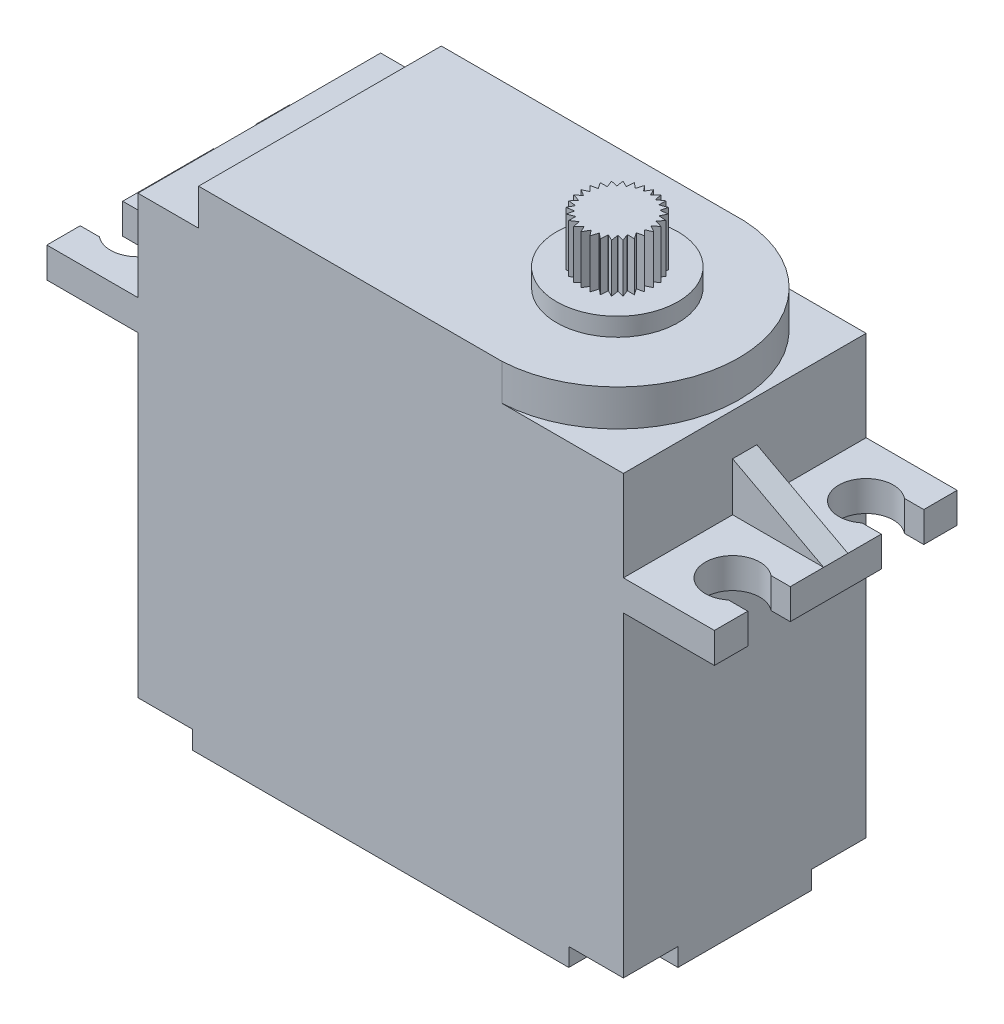
from build123d import *

# Parameters (mm, degrees)
SKETCH1_W           = 40
SKETCH1_H           = 20
BOSS_EXTRUDE1_DEPTH = 40.5
SKETCH2_R           = 5
BOSS_EXTRUDE2_DEPTH = 1.5
SKETCH3_W           = 20
SKETCH3_H           = 2.5
BOSS_EXTRUDE3_DEPTH = 7.5
SKETCH4_W           = 20
SKETCH4_H           = 2.5
BOSS_EXTRUDE4_DEPTH = 7.5
SKETCH5_W           = 5
SKETCH5_H           = 20
CUT_EXTRUDE1_DEPTH  = 3
SKETCH6_R           = 3
BOSS_EXTRUDE5_DEPTH = 4
SKETCH7_OUTSIDE_W   = 71.888
SKETCH7_OUTSIDE_H   = 36.888
CUT_EXTRUDE2_DEPTH  = 4
BOSS_EXTRUDE6_START = 4
SKETCH8_R           = 2.500178688
BOSS_EXTRUDE6_DEPTH = 4
SKETCH9_W           = 7.5
SKETCH9_H           = 2
BOSS_EXTRUDE7_DEPTH = 4
CHAMFER1_SIZE2      = 7.5
CHAMFER1_SIZE       = 4
CHAMFER2_SIZE2      = 7.5
CHAMFER2_SIZE       = 4
CUT_EXTRUDE3_REACH  = 61.659
SKETCH11_W          = 4.5
SKETCH11_H          = 4.5
CUT_EXTRUDE4_DEPTH  = 1.5
FILLET1_R           = 2.25


with BuildPart() as part:
    # Sketch1 → Boss-Extrude1 (new body)
    with BuildSketch(Plane(origin=(0, 0, 0), x_dir=(1, 0, 0), z_dir=(0, 1, 0))):
        with Locations((20, 10)):
            Rectangle(SKETCH1_W, SKETCH1_H)
    extrude(amount=BOSS_EXTRUDE1_DEPTH)

    # Sketch2 → Boss-Extrude2 (add)
    with BuildSketch(Plane(origin=(0, 40.5, 0), x_dir=(1, 0, 0), z_dir=(0, 1, 0))):
        with Locations(Location((29.5, 10, 0), (0, 0, 90))):
            Circle(SKETCH2_R)
    extrude(amount=BOSS_EXTRUDE2_DEPTH)

    # Sketch3 → Boss-Extrude3 (add)
    with BuildSketch(Plane(origin=(40, 0, 0), x_dir=(0, 0, -1), z_dir=(1, 0, 0))):
        with Locations((10, 28.8)):
            Rectangle(SKETCH3_W, SKETCH3_H)
    extrude(amount=BOSS_EXTRUDE3_DEPTH)

    # Sketch4 → Boss-Extrude4 (add)
    with BuildSketch(Plane.ZY):
        with Locations((-10, 28.8)):
            Rectangle(SKETCH4_W, SKETCH4_H)
    extrude(amount=BOSS_EXTRUDE4_DEPTH)

    # Sketch5 → Cut-Extrude1 (cut)
    with BuildSketch(Plane(origin=(0, 40.5, 0), x_dir=(1, 0, 0), z_dir=(0, 1, 0))):
        with Locations((2.5, 10)):
            Rectangle(SKETCH5_W, SKETCH5_H)
        with BuildLine():
            Line((30, 0), (40, 0))
            Line((40, 0), (40, 20))
            Line((40, 20), (30, 20))
            ThreePointArc((30, 20), (39.512492197, 10), (30, 0))
        make_face()
    extrude(amount=-CUT_EXTRUDE1_DEPTH, mode=Mode.SUBTRACT)

    # Sketch6 → Boss-Extrude5 (add)
    with BuildSketch(Plane(origin=(0, 42, 0), x_dir=(1, 0, 0), z_dir=(0, 1, 0))):
        with Locations(Location((29.5, 10, 0), (0, 0, 270))):
            Circle(SKETCH6_R)
    extrude(amount=BOSS_EXTRUDE5_DEPTH)

    # Sketch7 outside → Cut-Extrude2 (cut)
    with BuildSketch(Plane(origin=(0, 46, 0), x_dir=(1, 0, 0), z_dir=(0, 1, 0))):
        with Locations((20, 10)):
            Rectangle(SKETCH7_OUTSIDE_W, SKETCH7_OUTSIDE_H)
        with BuildLine():
            Line((29.5, 13), (29.197535282, 12.481815579))
            ThreePointArc((29.197535282, 12.481815579), (29.467797841, 12.499971299), (29.738438382, 12.488782958))
            Line((29.738438382, 12.488782958), (29.5, 13))
        make_face(mode=Mode.SUBTRACT)
        with BuildLine():
            Line((30.167562802, 12.924783737), (29.757374624, 12.486896012))
            ThreePointArc((29.757374624, 12.486896012), (30.024901165, 12.444457453), (30.286266542, 12.373326442))
            Line((30.286266542, 12.373326442), (30.167562802, 12.924783737))
        make_face(mode=Mode.SUBTRACT)
        with BuildLine():
            Line((30.801651217, 12.702906604), (30.304308129, 12.367273095))
            ThreePointArc((30.304308129, 12.367273095), (30.555683752, 12.266368304), (30.794668015, 12.138861427))
            Line((30.794668015, 12.138861427), (30.801651217, 12.702906604))
        make_face(mode=Mode.SUBTRACT)
        with BuildLine():
            Line((31.370469406, 12.345494447), (30.810910265, 12.12894522))
            ThreePointArc((30.810910265, 12.12894522), (31.033529948, 11.974633984), (31.238149427, 11.79714497))
            Line((31.238149427, 11.79714497), (31.370469406, 12.345494447))
        make_face(mode=Mode.SUBTRACT)
        with BuildLine():
            Line((31.845494447, 11.870469406), (31.251777886, 11.783863142))
            ThreePointArc((31.251777886, 11.783863142), (31.434478549, 11.583883271), (31.594472769, 11.36531216))
            Line((31.594472769, 11.36531216), (31.845494447, 11.870469406))
        make_face(mode=Mode.SUBTRACT)
        with BuildLine():
            Line((32.202906604, 11.301651217), (31.60480405, 11.349330718))
            ThreePointArc((31.60480405, 11.349330718), (31.738424318, 11.113710037), (31.845770501, 10.865016897))
            Line((31.845770501, 10.865016897), (32.202906604, 11.301651217))
        make_face(mode=Mode.SUBTRACT)
        with BuildLine():
            Line((32.424783737, 10.667562802), (31.852286549, 10.847137217))
            ThreePointArc((31.852286549, 10.847137217), (31.930126144, 10.587690732), (31.979441504, 10.321346074))
            Line((31.979441504, 10.321346074), (32.424783737, 10.667562802))
        make_face(mode=Mode.SUBTRACT)
        with BuildLine():
            Line((32.5, 10), (31.981815579, 10.302464718))
            ThreePointArc((31.981815579, 10.302464718), (31.999971299, 10.032202159), (31.988782958, 9.761561618))
            Line((31.988782958, 9.761561618), (32.5, 10))
        make_face(mode=Mode.SUBTRACT)
        with BuildLine():
            Line((32.424783737, 9.332437198), (31.986896012, 9.742625376))
            ThreePointArc((31.986896012, 9.742625376), (31.944457453, 9.475098835), (31.873326442, 9.213733458))
            Line((31.873326442, 9.213733458), (32.424783737, 9.332437198))
        make_face(mode=Mode.SUBTRACT)
        with BuildLine():
            Line((32.202906604, 8.698348783), (31.867273095, 9.195691871))
            ThreePointArc((31.867273095, 9.195691871), (31.766368304, 8.944316248), (31.638861427, 8.705331985))
            Line((31.638861427, 8.705331985), (32.202906604, 8.698348783))
        make_face(mode=Mode.SUBTRACT)
        with BuildLine():
            Line((31.845494447, 8.129530594), (31.62894522, 8.689089735))
            ThreePointArc((31.62894522, 8.689089735), (31.474633984, 8.466470052), (31.29714497, 8.261850573))
            Line((31.29714497, 8.261850573), (31.845494447, 8.129530594))
        make_face(mode=Mode.SUBTRACT)
        with BuildLine():
            Line((31.370469406, 7.654505553), (31.283863142, 8.248222114))
            ThreePointArc((31.283863142, 8.248222114), (31.083883271, 8.065521451), (30.86531216, 7.905527231))
            Line((30.86531216, 7.905527231), (31.370469406, 7.654505553))
        make_face(mode=Mode.SUBTRACT)
        with BuildLine():
            Line((30.801651217, 7.297093396), (30.849330718, 7.89519595))
            ThreePointArc((30.849330718, 7.89519595), (30.613710037, 7.761575682), (30.365016897, 7.654229499))
            Line((30.365016897, 7.654229499), (30.801651217, 7.297093396))
        make_face(mode=Mode.SUBTRACT)
        with BuildLine():
            Line((30.167562802, 7.075216263), (30.347137217, 7.647713451))
            ThreePointArc((30.347137217, 7.647713451), (30.087690732, 7.569873856), (29.821346074, 7.520558496))
            Line((29.821346074, 7.520558496), (30.167562802, 7.075216263))
        make_face(mode=Mode.SUBTRACT)
        with BuildLine():
            Line((29.5, 7), (29.802464718, 7.518184421))
            ThreePointArc((29.802464718, 7.518184421), (29.532202159, 7.500028701), (29.261561618, 7.511217042))
            Line((29.261561618, 7.511217042), (29.5, 7))
        make_face(mode=Mode.SUBTRACT)
        with BuildLine():
            Line((28.832437198, 7.075216263), (29.242625376, 7.513103988))
            ThreePointArc((29.242625376, 7.513103988), (28.975098835, 7.555542547), (28.713733458, 7.626673558))
            Line((28.713733458, 7.626673558), (28.832437198, 7.075216263))
        make_face(mode=Mode.SUBTRACT)
        with BuildLine():
            Line((28.198348783, 7.297093396), (28.695691871, 7.632726905))
            ThreePointArc((28.695691871, 7.632726905), (28.444316248, 7.733631696), (28.205331985, 7.861138573))
            Line((28.205331985, 7.861138573), (28.198348783, 7.297093396))
        make_face(mode=Mode.SUBTRACT)
        with BuildLine():
            Line((27.629530594, 7.654505553), (28.189089735, 7.87105478))
            ThreePointArc((28.189089735, 7.87105478), (27.966470052, 8.025366016), (27.761850573, 8.20285503))
            Line((27.761850573, 8.20285503), (27.629530594, 7.654505553))
        make_face(mode=Mode.SUBTRACT)
        with BuildLine():
            Line((27.154505553, 8.129530594), (27.748222114, 8.216136858))
            ThreePointArc((27.748222114, 8.216136858), (27.565521451, 8.416116729), (27.405527231, 8.63468784))
            Line((27.405527231, 8.63468784), (27.154505553, 8.129530594))
        make_face(mode=Mode.SUBTRACT)
        with BuildLine():
            Line((26.797093396, 8.698348783), (27.39519595, 8.650669282))
            ThreePointArc((27.39519595, 8.650669282), (27.261575682, 8.886289963), (27.154229499, 9.134983103))
            Line((27.154229499, 9.134983103), (26.797093396, 8.698348783))
        make_face(mode=Mode.SUBTRACT)
        with BuildLine():
            Line((26.575216263, 9.332437198), (27.147713451, 9.152862783))
            ThreePointArc((27.147713451, 9.152862783), (27.069873856, 9.412309268), (27.020558496, 9.678653926))
            Line((27.020558496, 9.678653926), (26.575216263, 9.332437198))
        make_face(mode=Mode.SUBTRACT)
        with BuildLine():
            Line((26.5, 10), (27.018184421, 9.697535282))
            ThreePointArc((27.018184421, 9.697535282), (27.000028701, 9.967797841), (27.011217042, 10.238438382))
            Line((27.011217042, 10.238438382), (26.5, 10))
        make_face(mode=Mode.SUBTRACT)
        with BuildLine():
            Line((26.575216263, 10.667562802), (27.013103988, 10.257374624))
            ThreePointArc((27.013103988, 10.257374624), (27.055542547, 10.524901165), (27.126673558, 10.786266542))
            Line((27.126673558, 10.786266542), (26.575216263, 10.667562802))
        make_face(mode=Mode.SUBTRACT)
        with BuildLine():
            Line((26.797093396, 11.301651217), (27.132726905, 10.804308129))
            ThreePointArc((27.132726905, 10.804308129), (27.233631696, 11.055683752), (27.361138573, 11.294668015))
            Line((27.361138573, 11.294668015), (26.797093396, 11.301651217))
        make_face(mode=Mode.SUBTRACT)
        with BuildLine():
            Line((27.154505553, 11.870469406), (27.37105478, 11.310910265))
            ThreePointArc((27.37105478, 11.310910265), (27.525366016, 11.533529948), (27.70285503, 11.738149427))
            Line((27.70285503, 11.738149427), (27.154505553, 11.870469406))
        make_face(mode=Mode.SUBTRACT)
        with BuildLine():
            Line((27.629530594, 12.345494447), (27.716136858, 11.751777886))
            ThreePointArc((27.716136858, 11.751777886), (27.916116729, 11.934478549), (28.13468784, 12.094472769))
            Line((28.13468784, 12.094472769), (27.629530594, 12.345494447))
        make_face(mode=Mode.SUBTRACT)
        with BuildLine():
            Line((28.198348783, 12.702906604), (28.150669282, 12.10480405))
            ThreePointArc((28.150669282, 12.10480405), (28.386289963, 12.238424318), (28.634983103, 12.345770501))
            Line((28.634983103, 12.345770501), (28.198348783, 12.702906604))
        make_face(mode=Mode.SUBTRACT)
        with BuildLine():
            Line((28.832437198, 12.924783737), (28.652862783, 12.352286549))
            ThreePointArc((28.652862783, 12.352286549), (28.912309268, 12.430126144), (29.178653926, 12.479441504))
            Line((29.178653926, 12.479441504), (28.832437198, 12.924783737))
        make_face(mode=Mode.SUBTRACT)
    extrude(amount=-CUT_EXTRUDE2_DEPTH, mode=Mode.SUBTRACT)

    # Sketch8 → Boss-Extrude6 (add)
    with BuildSketch(Plane(origin=(0, 42, 0), x_dir=(1, 0, 0), z_dir=(0, 1, 0)).offset(BOSS_EXTRUDE6_START)):
        with Locations((29.5, 10)):
            Circle(SKETCH8_R)
    extrude(amount=-BOSS_EXTRUDE6_DEPTH)

    # Sketch9 → Boss-Extrude7 (add)
    with BuildSketch(Plane(origin=(0, 30.05, 0), x_dir=(1, 0, 0), z_dir=(0, 1, 0))):
        with Locations((-3.75, 10)):
            Rectangle(SKETCH9_W, SKETCH9_H)
        with Locations((43.75, 10)):
            Rectangle(SKETCH9_W, SKETCH9_H)
    extrude(amount=BOSS_EXTRUDE7_DEPTH)

    # Chamfer1
    chamfer1_edges = [part.edges().sort_by_distance(p)[0] for p in [
        (-7.5, 34.05, -10),
    ]]
    chamfer1_side = [part.faces().sort_by_distance(p)[0] for p in [
        (-7.5, 33.97, -10),
    ]]
    chamfer(chamfer1_edges, length=CHAMFER1_SIZE - 0.0001, length2=CHAMFER1_SIZE2 - 0.0001, reference=chamfer1_side[0])  # a hair under: the kernel refuses the full size

    # Chamfer2
    chamfer2_edges = [part.edges().sort_by_distance(p)[0] for p in [
        (47.5, 34.05, -10),
    ]]
    chamfer2_side = [part.faces().sort_by_distance(p)[0] for p in [
        (47.5, 33.97, -10),
    ]]
    chamfer(chamfer2_edges, length=CHAMFER2_SIZE - 0.0001, length2=CHAMFER2_SIZE2 - 0.0001, reference=chamfer2_side[0])  # a hair under: the kernel refuses the full size

    # Sketch10 → Cut-Extrude3 (cut, up to next)
    with BuildSketch(Plane(origin=(0, 30.05, 0), x_dir=(1, 0, 0), z_dir=(0, 1, 0)), mode=Mode.PRIVATE) as cut_extrude3_sk1:
        with BuildLine():
            Line((45.914213562, 17.25), (47.5, 17.25))
            Line((47.5, 17.25), (47.5, 13.75))
            Line((47.5, 13.75), (45.914213562, 13.75))
            ThreePointArc((45.914213562, 13.75), (42.25, 15.5), (45.914213562, 17.25))
        make_face()
    cut_extrude3_tool1 = extrude(cut_extrude3_sk1.sketch, amount=-CUT_EXTRUDE3_REACH, mode=Mode.PRIVATE) & part.part
    # Sketch10 → Cut-Extrude3 (cut, up to next)
    with BuildSketch(Plane(origin=(0, 30.05, 0), x_dir=(1, 0, 0), z_dir=(0, 1, 0)), mode=Mode.PRIVATE) as cut_extrude3_sk2:
        with BuildLine():
            Line((45.914213562, 2.75), (47.5, 2.75))
            Line((47.5, 2.75), (47.5, 6.25))
            Line((47.5, 6.25), (45.914213562, 6.25))
            ThreePointArc((45.914213562, 6.25), (42.25, 4.5), (45.914213562, 2.75))
        make_face()
    cut_extrude3_tool2 = extrude(cut_extrude3_sk2.sketch, amount=-CUT_EXTRUDE3_REACH, mode=Mode.PRIVATE) & part.part
    # Sketch10 → Cut-Extrude3 (cut, up to next)
    with BuildSketch(Plane(origin=(0, 30.05, 0), x_dir=(1, 0, 0), z_dir=(0, 1, 0)), mode=Mode.PRIVATE) as cut_extrude3_sk3:
        with BuildLine():
            Line((-5.914213562, 13.75), (-7.5, 13.75))
            Line((-7.5, 13.75), (-7.5, 17.25))
            Line((-7.5, 17.25), (-5.914213562, 17.25))
            ThreePointArc((-5.914213562, 17.25), (-2.25, 15.5), (-5.914213562, 13.75))
        make_face()
    cut_extrude3_tool3 = extrude(cut_extrude3_sk3.sketch, amount=-CUT_EXTRUDE3_REACH, mode=Mode.PRIVATE) & part.part
    # Sketch10 → Cut-Extrude3 (cut, up to next)
    with BuildSketch(Plane(origin=(0, 30.05, 0), x_dir=(1, 0, 0), z_dir=(0, 1, 0)), mode=Mode.PRIVATE) as cut_extrude3_sk4:
        with BuildLine():
            Line((-5.914213562, 2.75), (-7.5, 2.75))
            Line((-7.5, 2.75), (-7.5, 6.25))
            Line((-7.5, 6.25), (-5.914213562, 6.25))
            ThreePointArc((-5.914213562, 6.25), (-2.25, 4.5), (-5.914213562, 2.75))
        make_face()
    cut_extrude3_tool4 = extrude(cut_extrude3_sk4.sketch, amount=-CUT_EXTRUDE3_REACH, mode=Mode.PRIVATE) & part.part
    add(cut_extrude3_tool1.solids().sort_by_distance((44.946855, 30.05, -15.5))[0], mode=Mode.SUBTRACT)
    add(cut_extrude3_tool2.solids().sort_by_distance((44.946855, 30.05, -4.5))[0], mode=Mode.SUBTRACT)
    add(cut_extrude3_tool3.solids().sort_by_distance((-4.946855, 30.05, -15.5))[0], mode=Mode.SUBTRACT)
    add(cut_extrude3_tool4.solids().sort_by_distance((-4.946855, 30.05, -4.5))[0], mode=Mode.SUBTRACT)

    # Sketch11 → Cut-Extrude4 (cut)
    with BuildSketch(Plane.XZ):
        with Locations((2.25, -2.25)):
            Rectangle(SKETCH11_W, SKETCH11_H)
        with Locations((37.75, -2.25)):
            Rectangle(SKETCH11_W, SKETCH11_H)
        with Locations((2.25, -17.75)):
            Rectangle(SKETCH11_W, SKETCH11_H)
        with Locations((37.75, -17.75)):
            Rectangle(SKETCH11_W, SKETCH11_H)
    extrude(amount=-CUT_EXTRUDE4_DEPTH, mode=Mode.SUBTRACT)

    # Fillet1
    fillet1_edges = [part.edges().sort_by_distance(p)[0] for p in [
        (35.5, 0.75, -4.5),
        (4.5, 0.75, -15.5),
        (35.5, 0.75, -15.5),
        (4.5, 0.75, -4.5),
    ]]
    fillet(fillet1_edges, radius=FILLET1_R)


solid = part.part
